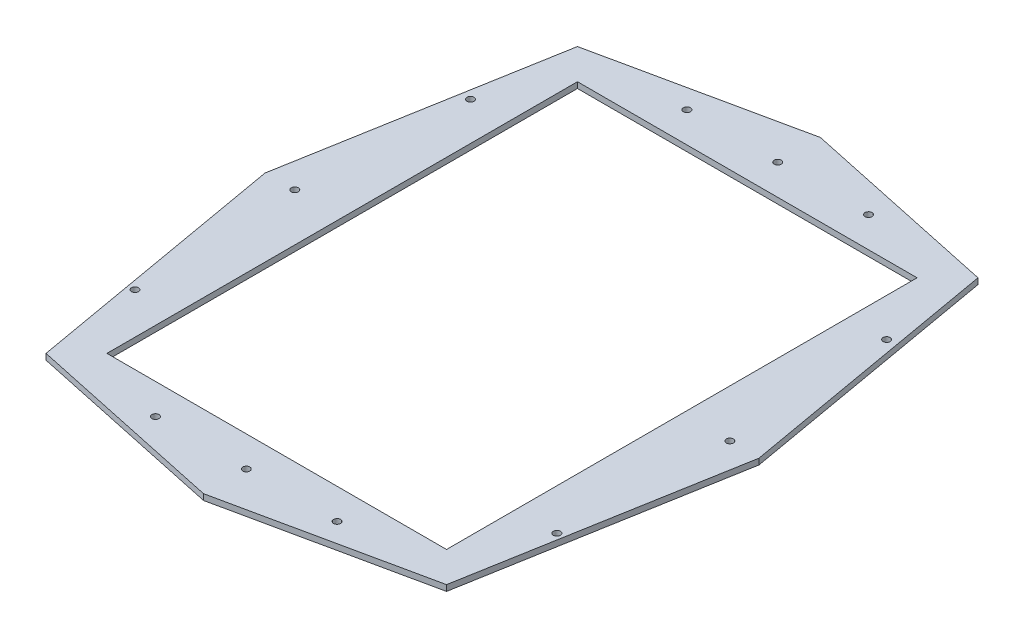
from build123d import *

# Parameters (mm, degrees)
SKETCH1_R           = 1.89865
SKETCH1_R_2         = 1.869185851
SKETCH1_W           = 182.3
SKETCH1_H           = 252.579753384
BOSS_EXTRUDE1_DEPTH = 3.175


with BuildPart() as part:
    # Sketch1 → Boss-Extrude1 (new body)
    with BuildSketch(Plane(origin=(0, -125.16391202, 0), x_dir=(-1, 0, 0), z_dir=(0, -1, 0))):
        Polygon((-107.5, 142.639876692), (-132.56321938, 0), (-107.5, -142.639876692), (0, -165.569938346), (107.5, -142.639876692), (132.56321938, 0), (107.5, 142.639876692), (0, 165.569938346), align=None)
        with Locations((-111.690160304, 89.410835528)):
            Circle(SKETCH1_R, mode=Mode.SUBTRACT)
        with Locations((-116.750007419, 0.165666821)):
            Circle(SKETCH1_R, mode=Mode.SUBTRACT)
        with Locations((-113.226895498, -89.153367391)):
            Circle(SKETCH1_R, mode=Mode.SUBTRACT)
        with Locations((-48.75, -142.639876692)):
            Circle(SKETCH1_R, mode=Mode.SUBTRACT)
        with Locations((0, -142.639876692)):
            Circle(SKETCH1_R, mode=Mode.SUBTRACT)
        with Locations((48.75, -142.639876692)):
            Circle(SKETCH1_R, mode=Mode.SUBTRACT)
        with Locations((113.226895498, -89.153367391)):
            Circle(SKETCH1_R_2, mode=Mode.SUBTRACT)
        with Locations((116.750007419, 0.165666821)):
            Circle(SKETCH1_R, mode=Mode.SUBTRACT)
        with Locations((111.690160304, 89.410835528)):
            Circle(SKETCH1_R, mode=Mode.SUBTRACT)
        with Locations((48.75, 142.639876692)):
            Circle(SKETCH1_R, mode=Mode.SUBTRACT)
        with Locations((0, 142.639876692)):
            Circle(SKETCH1_R, mode=Mode.SUBTRACT)
        with Locations((-48.75, 142.639876692)):
            Circle(SKETCH1_R, mode=Mode.SUBTRACT)
        Rectangle(SKETCH1_W, SKETCH1_H, mode=Mode.SUBTRACT)
    extrude(amount=BOSS_EXTRUDE1_DEPTH)


solid = part.part
